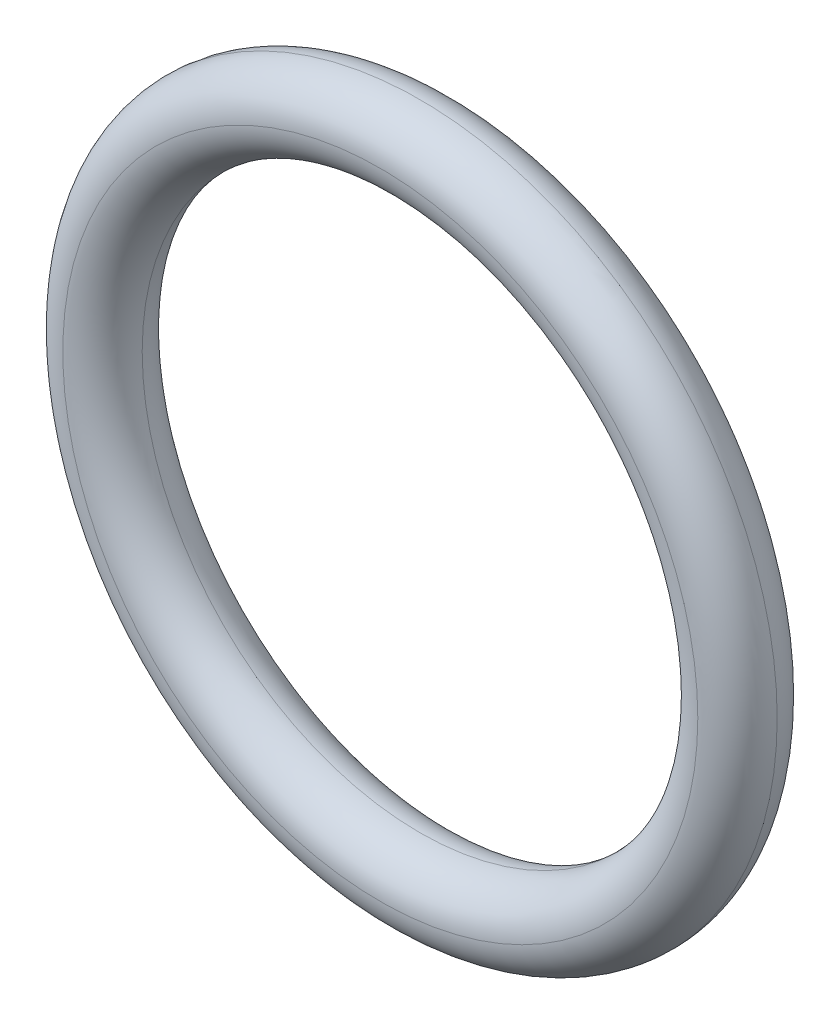
from build123d import *

# Parameters (mm, degrees)
SKETCH1_R           = 9
BOSS_EXTRUDE1_DEPTH = 2
SKETCH2_R           = 7
CUT_EXTRUDE1_DEPTH  = 2
FILLET1_R           = 1


with BuildPart() as part:
    # Sketch1 → Boss-Extrude1 (new body)
    with BuildSketch(Plane.XY):
        Circle(SKETCH1_R)
    extrude(amount=BOSS_EXTRUDE1_DEPTH)

    # Sketch2 → Cut-Extrude1 (cut)
    with BuildSketch(Plane.XY.offset(2)):
        Circle(SKETCH2_R)
    extrude(amount=-CUT_EXTRUDE1_DEPTH, mode=Mode.SUBTRACT)

    # Fillet1
    fillet1_edges = [part.edges().sort_by_distance(p)[0] for p in [
        (-9, 0, 0),
        (-9, 0, 2),
        (-7, 0, 0),
        (-7, 0, 2),
    ]]
    fillet(fillet1_edges, radius=FILLET1_R - 0.0001)  # a hair under: the kernel refuses the full size


solid = part.part
